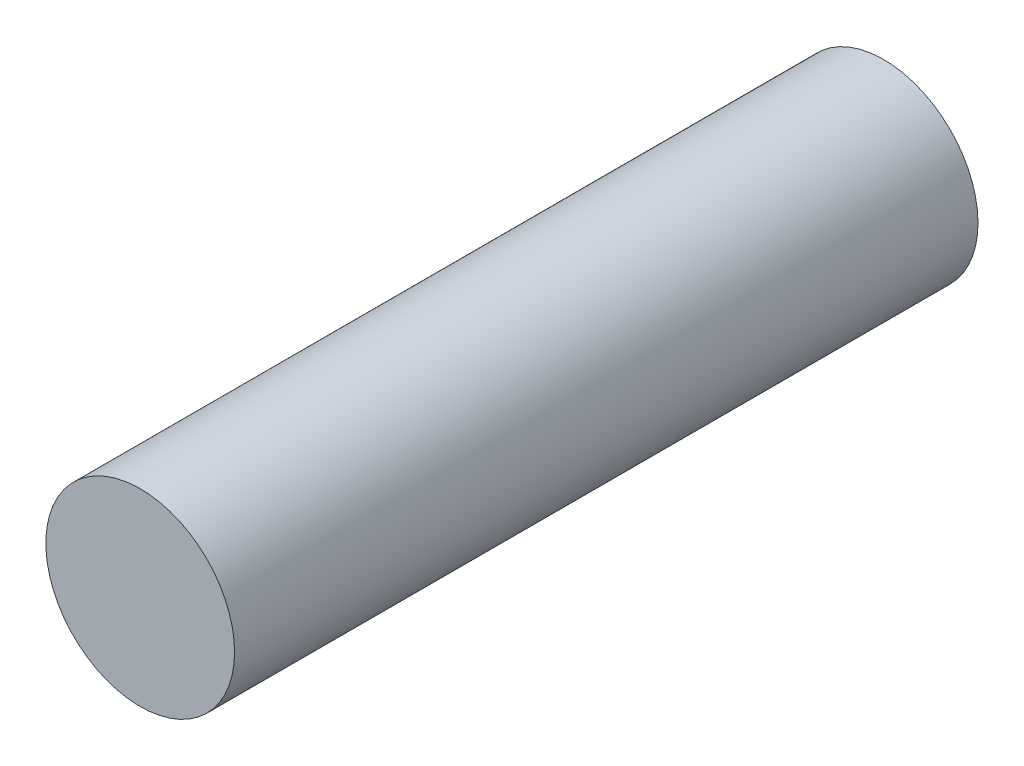
from build123d import *

# Parameters (mm, degrees)
SKETCH1_R           = 35.5406
BOSS_EXTRUDE1_DEPTH = 140


with BuildPart() as part:
    # Sketch1 → Boss-Extrude1 (new, symmetric)
    with BuildSketch(Plane.XY):
        Circle(SKETCH1_R)
    extrude(amount=BOSS_EXTRUDE1_DEPTH, both=True)


solid = part.part
